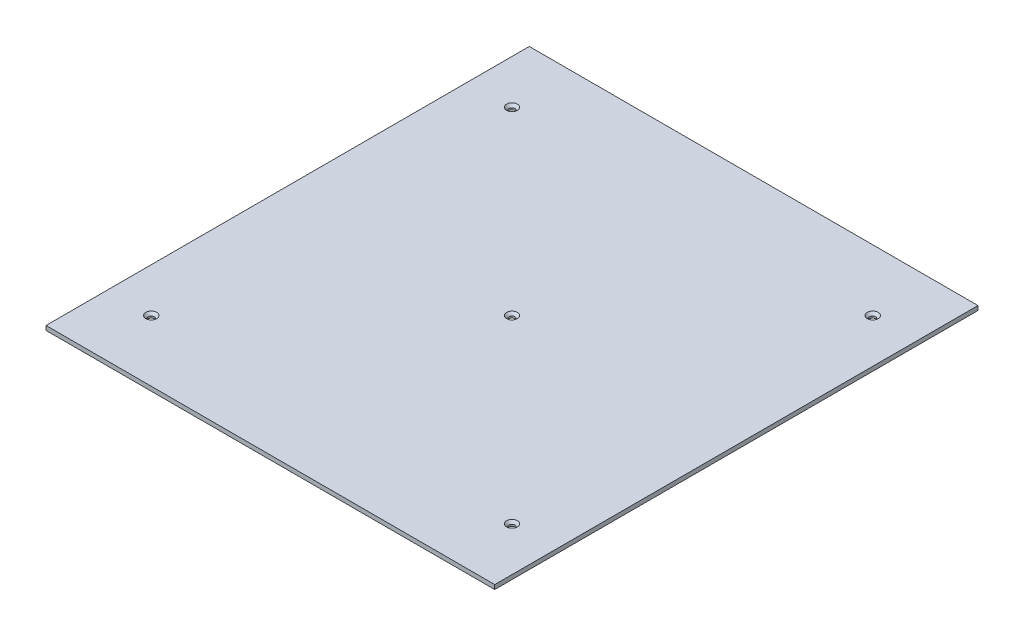
from build123d import *

# Parameters (mm, degrees)
SKETCH1_W                                      = 260
SKETCH1_H                                      = 280
BOSS_EXTRUDE1_DEPTH                            = 2.5
CSK_FOR_M3_FLAT_HEAD_MACHINE_SCREW1_AT_2_COUNT = 2
CSK_FOR_M3_FLAT_HEAD_MACHINE_SCREW1_AT_2_PITCH = 147.785317268
CSK_FOR_M3_FLAT_HEAD_MACHINE_SCREW1_AT_3_COUNT = 2
CSK_FOR_M3_FLAT_HEAD_MACHINE_SCREW1_AT_3_PITCH = 147.785317268
CSK_FOR_M3_FLAT_HEAD_MACHINE_SCREW1_AT_4_COUNT = 2
CSK_FOR_M3_FLAT_HEAD_MACHINE_SCREW1_AT_4_PITCH = 147.785317268
CSK_FOR_M3_FLAT_HEAD_MACHINE_SCREW1_AT_5_COUNT = 2
CSK_FOR_M3_FLAT_HEAD_MACHINE_SCREW1_AT_5_PITCH = 147.785317268


with BuildPart() as part:
    # Sketch1 → Boss-Extrude1 (new body)
    with BuildSketch(Plane(origin=(0, 0, 0), x_dir=(1, 0, 0), z_dir=(0, 1, 0))):
        Rectangle(SKETCH1_W, SKETCH1_H)
    extrude(amount=BOSS_EXTRUDE1_DEPTH)

    # Sketch2 → CSK for M3 Flat Head Machine Screw1 (revolve, cut)
    with BuildSketch(Plane(origin=(0, 2.5, 0), x_dir=(0, 0, 1), z_dir=(1, 0, 0))):
        Polygon((0, 0), (0, 2.5), (1.7, 2.5), (1.7, 1.45), (3.15, 0), align=None)
    csk_for_m3_flat_head_machine_screw1 = revolve(axis=Axis((0, 8.85, 0), (0, -1, 0)), mode=Mode.SUBTRACT)

    # CSK for M3 Flat Head Machine Screw1 at 2: CSK for M3 Flat Head Machine Screw1 ×2
    with Locations(*[Vector(-0.7071067811865471, 0, 0.7071067811865479) * (i * CSK_FOR_M3_FLAT_HEAD_MACHINE_SCREW1_AT_2_PITCH) for i in range(1, CSK_FOR_M3_FLAT_HEAD_MACHINE_SCREW1_AT_2_COUNT)]):
        add(csk_for_m3_flat_head_machine_screw1, mode=Mode.SUBTRACT)

    # CSK for M3 Flat Head Machine Screw1 at 3: CSK for M3 Flat Head Machine Screw1 ×2
    with Locations(*[Vector(-0.7071067811865478, 0, -0.7071067811865474) * (i * CSK_FOR_M3_FLAT_HEAD_MACHINE_SCREW1_AT_3_PITCH) for i in range(1, CSK_FOR_M3_FLAT_HEAD_MACHINE_SCREW1_AT_3_COUNT)]):
        add(csk_for_m3_flat_head_machine_screw1, mode=Mode.SUBTRACT)

    # CSK for M3 Flat Head Machine Screw1 at 4: CSK for M3 Flat Head Machine Screw1 ×2
    with Locations(*[Vector(0.7071067811865477, 0, 0.7071067811865474) * (i * CSK_FOR_M3_FLAT_HEAD_MACHINE_SCREW1_AT_4_PITCH) for i in range(1, CSK_FOR_M3_FLAT_HEAD_MACHINE_SCREW1_AT_4_COUNT)]):
        add(csk_for_m3_flat_head_machine_screw1, mode=Mode.SUBTRACT)

    # CSK for M3 Flat Head Machine Screw1 at 5: CSK for M3 Flat Head Machine Screw1 ×2
    with Locations(*[Vector(0.7071067811865477, 0, -0.7071067811865475) * (i * CSK_FOR_M3_FLAT_HEAD_MACHINE_SCREW1_AT_5_PITCH) for i in range(1, CSK_FOR_M3_FLAT_HEAD_MACHINE_SCREW1_AT_5_COUNT)]):
        add(csk_for_m3_flat_head_machine_screw1, mode=Mode.SUBTRACT)


solid = part.part
